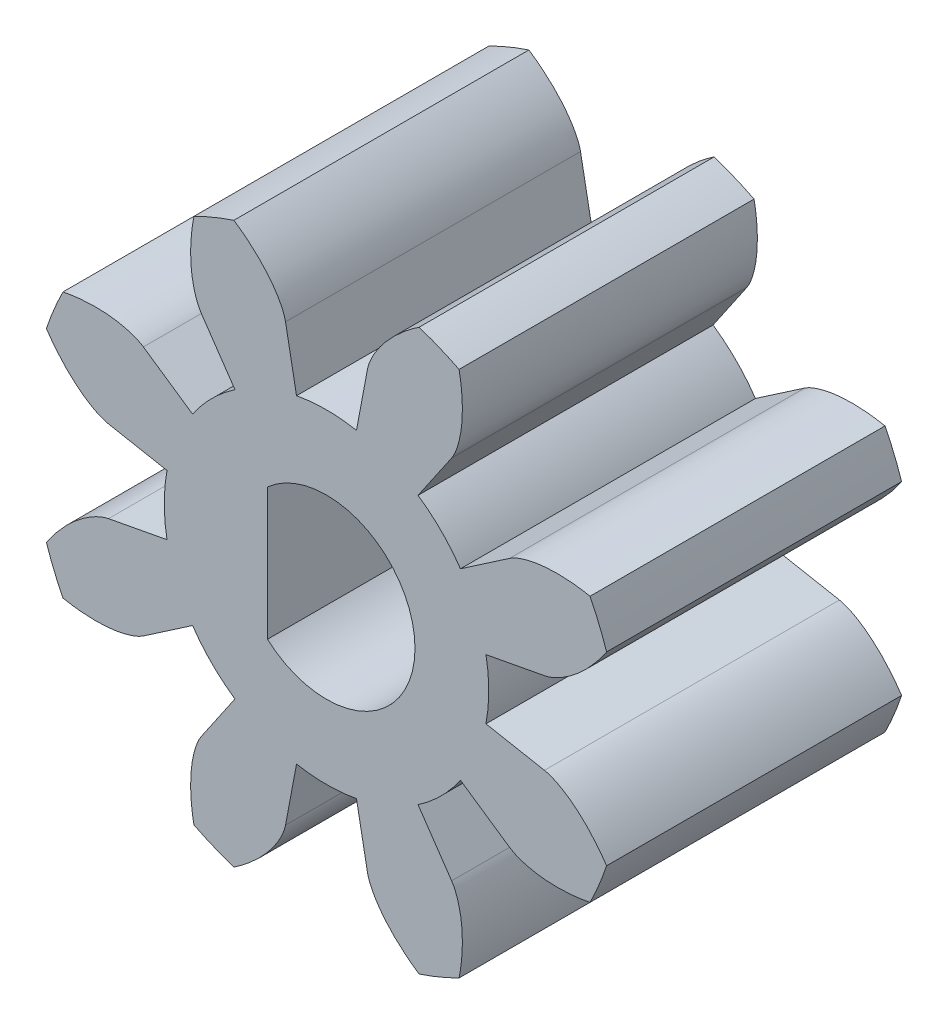
from build123d import *

# Parameters (mm, degrees)
SKETCH_1_R               = 5
SKETCH_1_R_2             = 1.5
EXTRUDE_1_DEPTH          = 5
CUT_EXTRUDE_1_DEPTH      = 9.660254038
PATTERN_CIRCULAR_1_DEPTH = 5
SKETCH_2_R               = 1.55
EXTRUDE_2_DEPTH          = 5
CUT_EXTRUDE_2_DEPTH      = 9.370943145


# Read off the part's stored shape, not the designer's step: 阵列(圆周)1
with BuildPart() as part:
    # 草图1 → 凸台-拉伸1 (new body)
    with BuildSketch(Plane.XY):
        Circle(SKETCH_1_R)
        Circle(SKETCH_1_R_2, mode=Mode.SUBTRACT)
    extrude(amount=EXTRUDE_1_DEPTH)

    # 草图1<3> → 切除-拉伸1 (cut, through all)
    with BuildSketch(Plane.XY):
        with BuildLine():
            Line((3.694052861, 0.694499102), (2.70265115, 0.508110974))
            ThreePointArc((2.70265115, 0.508110974), (2.738137201, 0.255156165), (2.75, 0))
            ThreePointArc((2.75, 0), (2.738137201, -0.255156165), (2.70265115, -0.508110974))
            Line((2.70265115, -0.508110974), (3.694052861, -0.694499102))
            add(Edge.make_bspline(
                [(3.694052861, -0.694499102), (3.722211627, -0.699793081), (3.799693178, -0.720419243), (3.940318318, -0.782609443), (4.152220935, -0.913709849), (4.396753171, -1.123866204), (4.57470903, -1.327029126), (4.691039069, -1.485797488), (4.747245846, -1.569604051)],
                knots=[0, 0, 0, 0, 0, 0.005604068, 0.015718248, 0.029959916, 0.048733667, 0.068515916, 0.068515916, 0.068515916, 0.068515916, 0.068515916], degree=4))
            ThreePointArc((4.747245846, -1.569604051), (4.936407055, -0.794912187), (5, 0))
            ThreePointArc((5, 0), (4.936407055, 0.794912187), (4.747245846, 1.569604051))
            add(Edge.make_bspline(
                [(3.694052861, 0.694499102), (3.722211627, 0.699793081), (3.799693178, 0.720419243), (3.940318318, 0.782609443), (4.152220935, 0.913709849), (4.396753171, 1.123866204), (4.57470903, 1.327029126), (4.691039069, 1.485797488), (4.747245846, 1.569604051)],
                knots=[0, 0, 0, 0, 0, 0.005604068, 0.015718248, 0.029959916, 0.048733667, 0.068515916, 0.068515916, 0.068515916, 0.068515916, 0.068515916], degree=4))
        make_face()
    extrude(amount=CUT_EXTRUDE_1_DEPTH, mode=Mode.SUBTRACT)

    # 阵列(圆周)1 outline → 阵列(圆周)1 (cut)
    with BuildSketch(Plane.XY):
        with BuildLine():
            Line((2.27035167, 1.55177424), (3.103174853, 2.121004804))
            add(Edge.make_bspline(
                [(3.103174853, 2.121004804), (3.126829515, 2.13717265), (3.196202145, 2.177375481), (3.339614247, 2.232837358), (3.582154011, 2.289973149), (3.903667396, 2.314280568), (4.173159071, 2.296456483), (4.367683015, 2.266448057), (4.466687398, 2.246932061)],
                knots=[0, 0, 0, 0, 0, 0.005604068, 0.015718248, 0.029959916, 0.048733667, 0.068515916, 0.068515916, 0.068515916, 0.068515916, 0.068515916], degree=4))
            ThreePointArc((4.466687398, 2.246932061), (3.535533906, 3.535533906), (2.246932061, 4.466687398))
            add(Edge.make_bspline(
                [(2.121004804, 3.103174853), (2.13717265, 3.126829515), (2.177375481, 3.196202145), (2.232837358, 3.339614247), (2.289973149, 3.582154011), (2.314280568, 3.903667396), (2.296456483, 4.173159071), (2.266448057, 4.367683015), (2.246932061, 4.466687398)],
                knots=[0, 0, 0, 0, 0, 0.005604068, 0.015718248, 0.029959916, 0.048733667, 0.068515916, 0.068515916, 0.068515916, 0.068515916, 0.068515916], degree=4))
            Line((2.121004804, 3.103174853), (1.55177424, 2.27035167))
            ThreePointArc((1.55177424, 2.27035167), (1.944543648, 1.944543648), (2.27035167, 1.55177424))
        make_face()
        with BuildLine():
            add(Edge.make_bspline(
                [(2.121004804, -3.103174853), (2.13717265, -3.126829515), (2.177375481, -3.196202145), (2.232837358, -3.339614247), (2.289973149, -3.582154011), (2.314280568, -3.903667396), (2.296456483, -4.173159071), (2.266448057, -4.367683015), (2.246932061, -4.466687398)],
                knots=[0, 0, 0, 0, 0, 0.005604068, 0.015718248, 0.029959916, 0.048733667, 0.068515916, 0.068515916, 0.068515916, 0.068515916, 0.068515916], degree=4))
            ThreePointArc((2.246932061, -4.466687398), (3.535533906, -3.535533906), (4.466687398, -2.246932061))
            add(Edge.make_bspline(
                [(3.103174853, -2.121004804), (3.126829515, -2.13717265), (3.196202145, -2.177375481), (3.339614247, -2.232837358), (3.582154011, -2.289973149), (3.903667396, -2.314280568), (4.173159071, -2.296456483), (4.367683015, -2.266448057), (4.466687398, -2.246932061)],
                knots=[0, 0, 0, 0, 0, 0.005604068, 0.015718248, 0.029959916, 0.048733667, 0.068515916, 0.068515916, 0.068515916, 0.068515916, 0.068515916], degree=4))
            Line((3.103174853, -2.121004804), (2.27035167, -1.55177424))
            ThreePointArc((2.27035167, -1.55177424), (1.944543648, -1.944543648), (1.55177424, -2.27035167))
            Line((1.55177424, -2.27035167), (2.121004804, -3.103174853))
        make_face()
        with BuildLine():
            add(Edge.make_bspline(
                [(-0.694499102, -3.694052861), (-0.699793081, -3.722211627), (-0.720419243, -3.799693178), (-0.782609443, -3.940318318), (-0.913709849, -4.152220935), (-1.123866204, -4.396753171), (-1.327029126, -4.57470903), (-1.485797488, -4.691039069), (-1.569604051, -4.747245846)],
                knots=[0, 0, 0, 0, 0, 0.005604068, 0.015718248, 0.029959916, 0.048733667, 0.068515916, 0.068515916, 0.068515916, 0.068515916, 0.068515916], degree=4))
            ThreePointArc((-1.569604051, -4.747245846), (0, -5), (1.569604051, -4.747245846))
            add(Edge.make_bspline(
                [(0.694499102, -3.694052861), (0.699793081, -3.722211627), (0.720419243, -3.799693178), (0.782609443, -3.940318318), (0.913709849, -4.152220935), (1.123866204, -4.396753171), (1.327029126, -4.57470903), (1.485797488, -4.691039069), (1.569604051, -4.747245846)],
                knots=[0, 0, 0, 0, 0, 0.005604068, 0.015718248, 0.029959916, 0.048733667, 0.068515916, 0.068515916, 0.068515916, 0.068515916, 0.068515916], degree=4))
            Line((0.694499102, -3.694052861), (0.508110974, -2.70265115))
            ThreePointArc((0.508110974, -2.70265115), (0, -2.75), (-0.508110974, -2.70265115))
            Line((-0.508110974, -2.70265115), (-0.694499102, -3.694052861))
        make_face()
        with BuildLine():
            add(Edge.make_bspline(
                [(-3.103174853, -2.121004804), (-3.126829515, -2.13717265), (-3.196202145, -2.177375481), (-3.339614247, -2.232837358), (-3.582154011, -2.289973149), (-3.903667396, -2.314280568), (-4.173159071, -2.296456483), (-4.367683015, -2.266448057), (-4.466687398, -2.246932061)],
                knots=[0, 0, 0, 0, 0, 0.005604068, 0.015718248, 0.029959916, 0.048733667, 0.068515916, 0.068515916, 0.068515916, 0.068515916, 0.068515916], degree=4))
            ThreePointArc((-4.466687398, -2.246932061), (-3.535533906, -3.535533906), (-2.246932061, -4.466687398))
            add(Edge.make_bspline(
                [(-2.121004804, -3.103174853), (-2.13717265, -3.126829515), (-2.177375481, -3.196202145), (-2.232837358, -3.339614247), (-2.289973149, -3.582154011), (-2.314280568, -3.903667396), (-2.296456483, -4.173159071), (-2.266448057, -4.367683015), (-2.246932061, -4.466687398)],
                knots=[0, 0, 0, 0, 0, 0.005604068, 0.015718248, 0.029959916, 0.048733667, 0.068515916, 0.068515916, 0.068515916, 0.068515916, 0.068515916], degree=4))
            Line((-2.121004804, -3.103174853), (-1.55177424, -2.27035167))
            ThreePointArc((-1.55177424, -2.27035167), (-1.944543648, -1.944543648), (-2.27035167, -1.55177424))
            Line((-2.27035167, -1.55177424), (-3.103174853, -2.121004804))
        make_face()
        with BuildLine():
            add(Edge.make_bspline(
                [(-3.694052861, 0.694499102), (-3.722211627, 0.699793081), (-3.799693178, 0.720419243), (-3.940318318, 0.782609443), (-4.152220935, 0.913709849), (-4.396753171, 1.123866204), (-4.57470903, 1.327029126), (-4.691039069, 1.485797488), (-4.747245846, 1.569604051)],
                knots=[0, 0, 0, 0, 0, 0.005604068, 0.015718248, 0.029959916, 0.048733667, 0.068515916, 0.068515916, 0.068515916, 0.068515916, 0.068515916], degree=4))
            ThreePointArc((-4.747245846, 1.569604051), (-5, 0), (-4.747245846, -1.569604051))
            add(Edge.make_bspline(
                [(-3.694052861, -0.694499102), (-3.722211627, -0.699793081), (-3.799693178, -0.720419243), (-3.940318318, -0.782609443), (-4.152220935, -0.913709849), (-4.396753171, -1.123866204), (-4.57470903, -1.327029126), (-4.691039069, -1.485797488), (-4.747245846, -1.569604051)],
                knots=[0, 0, 0, 0, 0, 0.005604068, 0.015718248, 0.029959916, 0.048733667, 0.068515916, 0.068515916, 0.068515916, 0.068515916, 0.068515916], degree=4))
            Line((-3.694052861, -0.694499102), (-2.70265115, -0.508110974))
            ThreePointArc((-2.70265115, -0.508110974), (-2.75, 0), (-2.70265115, 0.508110974))
            Line((-2.70265115, 0.508110974), (-3.694052861, 0.694499102))
        make_face()
        with BuildLine():
            add(Edge.make_bspline(
                [(-2.121004804, 3.103174853), (-2.13717265, 3.126829515), (-2.177375481, 3.196202145), (-2.232837358, 3.339614247), (-2.289973149, 3.582154011), (-2.314280568, 3.903667396), (-2.296456483, 4.173159071), (-2.266448057, 4.367683015), (-2.246932061, 4.466687398)],
                knots=[0, 0, 0, 0, 0, 0.005604068, 0.015718248, 0.029959916, 0.048733667, 0.068515916, 0.068515916, 0.068515916, 0.068515916, 0.068515916], degree=4))
            ThreePointArc((-2.246932061, 4.466687398), (-3.535533906, 3.535533906), (-4.466687398, 2.246932061))
            add(Edge.make_bspline(
                [(-3.103174853, 2.121004804), (-3.126829515, 2.13717265), (-3.196202145, 2.177375481), (-3.339614247, 2.232837358), (-3.582154011, 2.289973149), (-3.903667396, 2.314280568), (-4.173159071, 2.296456483), (-4.367683015, 2.266448057), (-4.466687398, 2.246932061)],
                knots=[0, 0, 0, 0, 0, 0.005604068, 0.015718248, 0.029959916, 0.048733667, 0.068515916, 0.068515916, 0.068515916, 0.068515916, 0.068515916], degree=4))
            Line((-3.103174853, 2.121004804), (-2.27035167, 1.55177424))
            ThreePointArc((-2.27035167, 1.55177424), (-1.944543648, 1.944543648), (-1.55177424, 2.27035167))
            Line((-1.55177424, 2.27035167), (-2.121004804, 3.103174853))
        make_face()
        with BuildLine():
            add(Edge.make_bspline(
                [(0.694499102, 3.694052861), (0.699793081, 3.722211627), (0.720419243, 3.799693178), (0.782609443, 3.940318318), (0.913709849, 4.152220935), (1.123866204, 4.396753171), (1.327029126, 4.57470903), (1.485797488, 4.691039069), (1.569604051, 4.747245846)],
                knots=[0, 0, 0, 0, 0, 0.005604068, 0.015718248, 0.029959916, 0.048733667, 0.068515916, 0.068515916, 0.068515916, 0.068515916, 0.068515916], degree=4))
            ThreePointArc((1.569604051, 4.747245846), (0, 5), (-1.569604051, 4.747245846))
            add(Edge.make_bspline(
                [(-0.694499102, 3.694052861), (-0.699793081, 3.722211627), (-0.720419243, 3.799693178), (-0.782609443, 3.940318318), (-0.913709849, 4.152220935), (-1.123866204, 4.396753171), (-1.327029126, 4.57470903), (-1.485797488, 4.691039069), (-1.569604051, 4.747245846)],
                knots=[0, 0, 0, 0, 0, 0.005604068, 0.015718248, 0.029959916, 0.048733667, 0.068515916, 0.068515916, 0.068515916, 0.068515916, 0.068515916], degree=4))
            Line((-0.694499102, 3.694052861), (-0.508110974, 2.70265115))
            ThreePointArc((-0.508110974, 2.70265115), (0, 2.75), (0.508110974, 2.70265115))
            Line((0.508110974, 2.70265115), (0.694499102, 3.694052861))
        make_face()
    extrude(amount=PATTERN_CIRCULAR_1_DEPTH, mode=Mode.SUBTRACT)

    # 草图2 → 凸台-拉伸2 (add, through all)
    with BuildSketch(Plane.XY.offset(5)):
        Circle(SKETCH_2_R)
    extrude(amount=-EXTRUDE_2_DEPTH)

    # 草图2<3> → 切除-拉伸2 (cut, through all)
    with BuildSketch(Plane.XY.offset(5)):
        with BuildLine():
            ThreePointArc((1.5, 0), (0.612372436, 1.369306394), (-1, 1.118033989))
            Line((-1, 1.118033989), (-1, -1.118033989))
            ThreePointArc((-1, -1.118033989), (0.612372436, -1.369306394), (1.5, 0))
        make_face()
    extrude(amount=-CUT_EXTRUDE_2_DEPTH, mode=Mode.SUBTRACT)


solid = part.part
